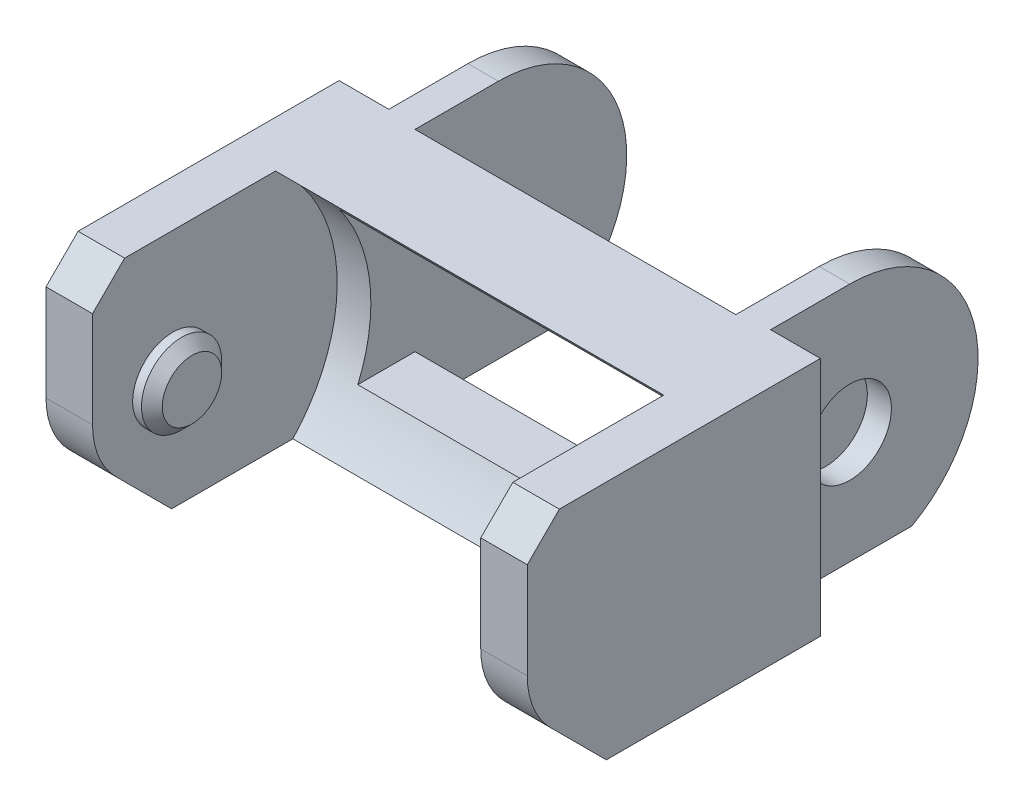
from build123d import *

# Parameters (mm, degrees)
SKETCH_1_W               = 30
SKETCH_1_H               = 15
EXTRUDE_1_DEPTH          = 18
CUT_EXTRUDE_1_REACH      = 28.843
SKETCH_2_W               = 20
SKETCH_2_H               = 10
CUT_EXTRUDE_2_REACH      = 29.668
SKETCH_3_W               = 20
SKETCH_3_H               = 12
CUT_EXTRUDE_5_DEPTH      = 22.1
CUT_EXTRUDE_5_DEPTH_BACK = 2.1
SKETCH_5_R               = 2.5
EXTRUDE_2_DEPTH          = 1.2
EXTRUDE_START            = 1.2
SKETCH_6_R               = 2.5
EXTRUDE_3_DEPTH          = 1.2
CHAMFER_1_SIZE           = 0.65
CUT_EXTRUDE_6_DEPTH      = 35.020684023
CUT_EXTRUDE_6_DEPTH_BACK = 35.020684023
CUT_EXTRUDE_7_DEPTH      = 35.020684023
CUT_EXTRUDE_7_DEPTH_BACK = 35.020684023
SKETCH_9_W               = 1.9
SKETCH_9_H               = 15
EXTRUDE_4_DEPTH          = 20
SKETCH_10_R              = 2.6
CUT_EXTRUDE_8_DEPTH      = 35.965796737
CUT_EXTRUDE_9_DEPTH      = 35.965796737
CUT_EXTRUDE_9_DEPTH_BACK = 35.965796737
EXTRUDE_START_2          = 0.4
SKETCH_15_R              = 2.6
EXTRUDE_6_DEPTH          = 0.4
SKETCH_16_R              = 2.6
EXTRUDE_7_DEPTH          = 0.4
CHAMFER_2_SIZE           = 2
SKETCH_17_W              = 3.1
SKETCH_17_H              = 15
EXTRUDE_8_DEPTH          = 0.27


with BuildPart() as part:
    # 草圖1 → 填料-伸長1 (new body)
    with BuildSketch(Plane.XY):
        with Locations((2.249045701, -2.44972067)):
            Rectangle(SKETCH_1_W, SKETCH_1_H)
    extrude(amount=EXTRUDE_1_DEPTH)

    # 草圖2 → 除料-伸長1 (cut, up to next)
    with BuildSketch(Plane.XY.offset(18), mode=Mode.PRIVATE) as cut_extrude_1_sk1:
        with Locations((2.249045701, -1.94972067)):
            Rectangle(SKETCH_2_W, SKETCH_2_H)
    cut_extrude_1_tool1 = extrude(cut_extrude_1_sk1.sketch, amount=-CUT_EXTRUDE_1_REACH, mode=Mode.PRIVATE) & part.part
    add(cut_extrude_1_tool1.solids().sort_by_distance((2.249046, -1.949721, 18))[0], mode=Mode.SUBTRACT)

    # 草圖3 → 除料-伸長2 (cut, up to next)
    with BuildSketch(Plane(origin=(0, -6.94972067, 0), x_dir=(1, 0, 0), z_dir=(0, 1, 0)), mode=Mode.PRIVATE) as cut_extrude_2_sk1:
        with Locations((2.249045701, -12)):
            Rectangle(SKETCH_3_W, SKETCH_3_H)
    cut_extrude_2_tool1 = extrude(cut_extrude_2_sk1.sketch, amount=-CUT_EXTRUDE_2_REACH, mode=Mode.PRIVATE) & part.part
    add(cut_extrude_2_tool1.solids().sort_by_distance((2.249046, -6.949721, 12))[0], mode=Mode.SUBTRACT)

    # 草圖4 → 除料-伸長5 (cut, two sides: drawn at the far end of the back side and taken through both)
    with BuildSketch(Plane(origin=(-7.750954299, 0, 0), x_dir=(0, 0, -1), z_dir=(1, 0, 0)).offset(-CUT_EXTRUDE_5_DEPTH_BACK)):
        with BuildLine():
            Line((-13, 7.30027933), (-13, 7.89449882))
            Line((-13, 7.89449882), (-18, 7.89449882))
            Line((-18, 7.89449882), (-18, 5.998044414))
            ThreePointArc((-18, 5.998044414), (-10.416600313, -12.868820733), (-13, 7.30027933))
        make_face()
    extrude(amount=CUT_EXTRUDE_5_DEPTH + CUT_EXTRUDE_5_DEPTH_BACK, mode=Mode.SUBTRACT)

    # 草圖5 → 填料-伸長2 (add)
    with BuildSketch(Plane.ZY.offset(-14.349045701)):
        with Locations((13, -2.94972067)):
            Circle(SKETCH_5_R)
    extrude(amount=EXTRUDE_2_DEPTH)

    # 草圖6 → 填料-伸長3 (add)
    with BuildSketch(Plane(origin=(-9.850954299, 0, 0), x_dir=(0, 0, -1), z_dir=(1, 0, 0)).offset(EXTRUDE_START)):
        with Locations((-13, -2.94972067)):
            Circle(SKETCH_6_R)
    extrude(amount=-EXTRUDE_3_DEPTH)

    # 導角1
    chamfer_1_edges = [part.edges().sort_by_distance(p)[0] for p in [
        (-8.650954299, -2.94972067, 15.5),
        (13.149045701, -2.94972067, 10.5),
    ]]
    chamfer(chamfer_1_edges, length=CHAMFER_1_SIZE)

    # 草圖7 → 除料-伸長6 (cut, two sides: drawn at the far end of the back side and taken through both)
    with BuildSketch(Plane(origin=(-9.850954299, 0, 0), x_dir=(0, 0, -1), z_dir=(1, 0, 0)).offset(-CUT_EXTRUDE_6_DEPTH_BACK)):
        Polygon((-18, -9.94972067), (-13.071067812, -9.94972067), (-18, -5.020788482), align=None)
    extrude(amount=CUT_EXTRUDE_6_DEPTH + CUT_EXTRUDE_6_DEPTH_BACK, mode=Mode.SUBTRACT)

    # 草圖8 → 除料-伸長7 (cut, two sides: drawn at the far end of the back side and taken through both)
    with BuildSketch(Plane(origin=(-9.850954299, 0, 0), x_dir=(0, 0, -1), z_dir=(1, 0, 0)).offset(-CUT_EXTRUDE_7_DEPTH_BACK)):
        with BuildLine():
            Line((-18, -2.94972067), (-18, -5.020788482))
            Line((-18, -5.020788482), (-16.535533871, -6.485254612))
            ThreePointArc((-16.535533871, -6.485254612), (-17.619397653, -4.863137855), (-18, -2.94972067))
        make_face()
    extrude(amount=CUT_EXTRUDE_7_DEPTH + CUT_EXTRUDE_7_DEPTH_BACK, mode=Mode.SUBTRACT)

    # 草圖9 → 填料-伸長4 (add)
    with BuildSketch(Plane(origin=(0, 0, 0), x_dir=(-1, 0, 0), z_dir=(0, 0, -1))):
        with Locations((-13.199045701, -2.44972067)):
            Rectangle(SKETCH_9_W, SKETCH_9_H)
        with Locations((8.700954299, -2.44972067)):
            Rectangle(SKETCH_9_W, SKETCH_9_H)
    extrude(amount=EXTRUDE_4_DEPTH)

    # 草圖10 → 除料-伸長8 (cut, through all)
    with BuildSketch(Plane(origin=(14.149045701, 0, 0), x_dir=(0, 0, -1), z_dir=(1, 0, 0))):
        with Locations((5.2, -2.94972067)):
            Circle(SKETCH_10_R)
    extrude(amount=-CUT_EXTRUDE_8_DEPTH, mode=Mode.SUBTRACT)

    # 草圖12 → 除料-伸長9 (cut, two sides: drawn at the far end of the back side and taken through both)
    with BuildSketch(Plane(origin=(14.149045701, 0, 0), x_dir=(0, 0, -1), z_dir=(1, 0, 0)).offset(-CUT_EXTRUDE_9_DEPTH_BACK)):
        with BuildLine():
            ThreePointArc((5.2, 5.05027933), (12.945966692, -0.94972067), (9.072983346, -9.94972067))
            Line((9.072983346, -9.94972067), (20, -9.94972067))
            Line((20, -9.94972067), (20, 5.05027933))
            Line((20, 5.05027933), (5.2, 5.05027933))
        make_face()
    extrude(amount=CUT_EXTRUDE_9_DEPTH + CUT_EXTRUDE_9_DEPTH_BACK, mode=Mode.SUBTRACT)

    # 草圖15 → 填料-伸長6 (add)
    with BuildSketch(Plane(origin=(12.249045701, 0, 0), x_dir=(0, 0, -1), z_dir=(1, 0, 0)).offset(EXTRUDE_START_2)):
        with Locations((5.2, -2.94972067)):
            Circle(SKETCH_15_R)
    extrude(amount=-EXTRUDE_6_DEPTH)

    # 草圖16 → 填料-伸長7 (add)
    with BuildSketch(Plane.ZY.offset(7.750954299)):
        with Locations((-5.2, -2.94972067)):
            Circle(SKETCH_16_R)
    extrude(amount=EXTRUDE_7_DEPTH)

    # 導角2
    chamfer_2_edges = [part.edges().sort_by_distance(p)[0] for p in [
        (15.799045701, 5.05027933, 18),
        (-11.300954299, 5.05027933, 18),
    ]]
    chamfer(chamfer_2_edges, length=CHAMFER_2_SIZE)

    # 草圖17 → 填料-伸長8 (add)
    with BuildSketch(Plane(origin=(0, 0, 0), x_dir=(-1, 0, 0), z_dir=(0, 0, -1))):
        with Locations((-15.699045701, -2.44972067)):
            Rectangle(SKETCH_17_W, SKETCH_17_H)
        with Locations((11.200954299, -2.44972067)):
            Rectangle(SKETCH_17_W, SKETCH_17_H)
    extrude(amount=EXTRUDE_8_DEPTH)


solid = part.part
